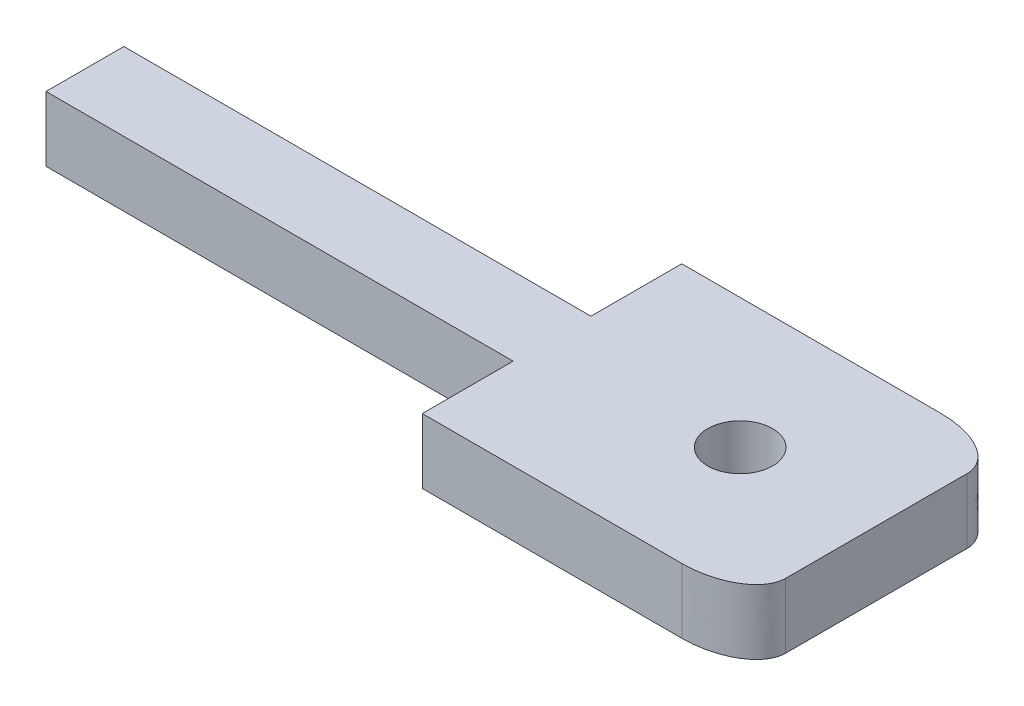
from build123d import *

# Parameters (mm, degrees)
BOSS_EXTRUDE1_DEPTH             = 20
CUT_EXTRUDE2_DEPTH              = 25.109126902
CUT_EXTRUDE2_DEPTH_BACK         = 25.109126902
SKETCH2_R                       = 2.5
FILLET1_SIZE                    = 3
FILLET1_SIZE_2                  = 5
BOSS_EXTRUDE2_REACH             = 25.717
SKETCH3_W                       = 36
SKETCH3_H                       = 6
BOSS_EXTRUDE2_DIRECTION_2_REACH = 25.717


with BuildPart() as part:
    # Sketch1 → Boss-Extrude1 (new body)
    with BuildSketch(Plane.XY):
        Polygon((6.5, 2.5), (12.5, 2.5), (12.5, -2.5), (-12.5, -2.5), (-12.5, 2.5), align=None)
    extrude(amount=BOSS_EXTRUDE1_DEPTH)

    # Sketch2 → Cut-Extrude2 (cut, two sides: drawn at the far end of the back side and taken through both)
    with BuildSketch(Plane(origin=(0, 2.5, 0), x_dir=(1, 0, 0), z_dir=(0, 1, 0)).offset(-CUT_EXTRUDE2_DEPTH_BACK)):
        with Locations(Location((2, -10, 0), (0, 0, 270))):
            Circle(SKETCH2_R)
    extrude(amount=CUT_EXTRUDE2_DEPTH + CUT_EXTRUDE2_DEPTH_BACK, mode=Mode.SUBTRACT)

    # Fillet1
    # an asymmetric fillet: 5, 3 mm, written as the material it takes off along each edge
    with BuildSketch(Plane(origin=(12.5, 15, 20), x_dir=(0, 0, -1), z_dir=(0, -1, 0))) as fillet1_piece_1:
        with BuildLine():
            Bezier((FILLET1_SIZE, 0), (0, 0), (0, -FILLET1_SIZE_2), weights=[1, 0.707106781, 1])
            Line((0, -FILLET1_SIZE_2), (0, 0))
            Line((0, 0), (FILLET1_SIZE, 0))
        make_face()
    extrude(amount=30, mode=Mode.SUBTRACT)
    with BuildSketch(Plane(origin=(12.5, 15, 0), x_dir=(0, 0, 1), z_dir=(0, -1, 0))) as fillet1_piece_2:
        with BuildLine():
            Bezier((FILLET1_SIZE, 0), (0, 0), (0, FILLET1_SIZE_2), weights=[1, 0.707106781, 1])
            Line((0, FILLET1_SIZE_2), (0, 0))
            Line((0, 0), (FILLET1_SIZE, 0))
        make_face()
    extrude(amount=30, mode=Mode.SUBTRACT)

    # Boss-Extrude2: up to this face of the body (flat: up to its plane)
    boss_extrude2_end = Plane(part.part.faces().sort_by_distance((12.179843785, 2.5, 10))[0])
    # Sketch3 → Boss-Extrude2 (add, up to the picked face)
    with BuildSketch(Plane(origin=(0, 0, 0), x_dir=(1, 0, 0), z_dir=(0, 1, 0)), mode=Mode.PRIVATE) as boss_extrude2_sk1:
        with Locations((-30.5, -10)):
            Rectangle(SKETCH3_W, SKETCH3_H)
    boss_extrude2_tool1 = split(extrude(boss_extrude2_sk1.sketch, amount=BOSS_EXTRUDE2_REACH, mode=Mode.PRIVATE), bisect_by=boss_extrude2_end, keep=Keep.BOTH, mode=Mode.PRIVATE)
    add(boss_extrude2_tool1.solids().sort_by(Axis((-30.5, 0, 10), (0, 1, 0)))[0])

    # Boss-Extrude2 direction 2: up to this face of the body (flat: up to its plane)
    boss_extrude2_direction_2_end = Plane(part.part.faces().sort_by_distance((-2.5, -2.5, 0.320156215))[0])
    # Sketch3 → Boss-Extrude2 direction 2 (add, up to the picked face)
    with BuildSketch(Plane(origin=(0, 0, 0), x_dir=(1, 0, 0), z_dir=(0, 1, 0)), mode=Mode.PRIVATE) as boss_extrude2_direction_2_sk1:
        with Locations((-30.5, -10)):
            Rectangle(SKETCH3_W, SKETCH3_H)
    boss_extrude2_direction_2_tool1 = split(extrude(boss_extrude2_direction_2_sk1.sketch, amount=-BOSS_EXTRUDE2_DIRECTION_2_REACH, mode=Mode.PRIVATE), bisect_by=boss_extrude2_direction_2_end, keep=Keep.BOTH, mode=Mode.PRIVATE)
    add(boss_extrude2_direction_2_tool1.solids().sort_by(Axis((-30.5, 0, 10), (0, -1, 0)))[0])


solid = part.part
